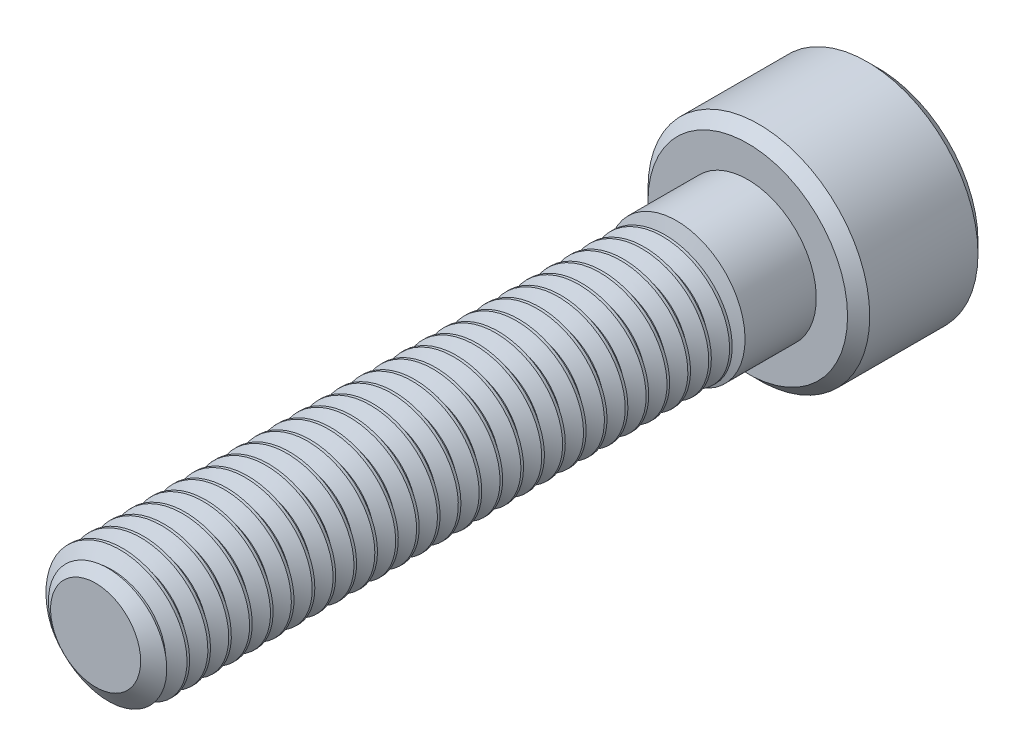
from build123d import *

# Parameters (mm, degrees)
SKETCH1_R          = 2.5
EXTRUDE1_DEPTH     = 25
CUT_SWEEP1_PITCH   = 0.8
SKETCH6_R          = 4.25
EXTRUDE2_DEPTH     = 5
CUT_EXTRUDE1_DEPTH = 3
CHAMFER1_SIZE      = 0.425


with BuildPart() as part:
    # Sketch1 → Extrude1 (new body)
    with BuildSketch(Plane.XY):
        Circle(SKETCH1_R)
    extrude(amount=-EXTRUDE1_DEPTH)

    # Cut-Sweep1: the profile of Sketch3 profile screwed along a right-hand helix of 32.25 turns, 6 arcs to a turn; built about Z, then put on its axis
    cut_sweep1_z = Axis((0, 0, 0), (0, 0, 1))
    cut_sweep1_corners = [(2.5003, 0, -0.700173205), (1.980384758, 0, -0.4), (1.980384758, 0, -0.3), (2.5003, 0, 0.000173205)]
    with BuildLine(mode=Mode.PRIVATE) as cut_sweep1_profile:
        Line(cut_sweep1_corners[0], cut_sweep1_corners[1])
        Line(cut_sweep1_corners[1], cut_sweep1_corners[2])
        Line(cut_sweep1_corners[2], cut_sweep1_corners[3])
        Line(cut_sweep1_corners[3], cut_sweep1_corners[0])
    cut_sweep1_cap = Face(cut_sweep1_profile.wire())
    cut_sweep1_turn_angles = [0, 30, 60, 90, 120, 150, 180, 210, 240, 270, 300, 330, 360]
    cut_sweep1_turn_weights = [1, 0.8660254037844387, 1, 0.8660254037844387, 1, 0.8660254037844387, 1, 0.8660254037844387, 1, 0.8660254037844387, 1, 0.8660254037844387, 1]
    cut_sweep1_turn_rails = [Edge.make_bspline([Vector(p[0], p[1], 0).rotate(cut_sweep1_z, cut_sweep1_turn_angles[k]) / cut_sweep1_turn_weights[k] + Vector(0, 0, p[2] + CUT_SWEEP1_PITCH * cut_sweep1_turn_angles[k] / 360) for k in range(13)], [0, 0, 0, 1, 1, 2, 2, 3, 3, 4, 4, 5, 5, 6, 6, 6], 2, cut_sweep1_turn_weights) for p in cut_sweep1_corners]
    cut_sweep1_turn_sides = [Face.make_surface_from_curves(cut_sweep1_turn_rails[p[0]], cut_sweep1_turn_rails[p[1]]) for p in [(0, 1), (1, 2), (2, 3), (3, 0)]]
    cut_sweep1_last_angles = [11520, 11550, 11580, 11595, 11610]
    cut_sweep1_last_weights = [1, 0.8660254037844387, 1, 0.9659258262891915, 1]
    cut_sweep1_last_rails = [Edge.make_bspline([Vector(p[0], p[1], 0).rotate(cut_sweep1_z, cut_sweep1_last_angles[k]) / cut_sweep1_last_weights[k] + Vector(0, 0, p[2] + CUT_SWEEP1_PITCH * cut_sweep1_last_angles[k] / 360) for k in range(5)], [0, 0, 0, 1, 1, 2, 2, 2], 2, cut_sweep1_last_weights) for p in cut_sweep1_corners]
    cut_sweep1_last_sides = [Face.make_surface_from_curves(cut_sweep1_last_rails[p[0]], cut_sweep1_last_rails[p[1]]) for p in [(0, 1), (1, 2), (2, 3), (3, 0)]]
    cut_sweep1 = Plane(origin=(0, 0, 0), x_dir=(0, 1, 0), z_dir=(0, 0, -1)) * Solid(Shell([*[p.moved(Location((0, 0, CUT_SWEEP1_PITCH * i))) for i in range(32) for p in cut_sweep1_turn_sides], *cut_sweep1_last_sides, cut_sweep1_cap, cut_sweep1_cap.rotate(cut_sweep1_z, 11610).moved(Location((0, 0, CUT_SWEEP1_PITCH * 11610 / 360)))]))
    add(cut_sweep1, mode=Mode.SUBTRACT)

    # Sketch4 → Cut-Revolve1 (revolve, cut)
    with BuildSketch(Plane(origin=(0, 0, 0), x_dir=(0, 0, -1), z_dir=(1, 0, 0)), mode=Mode.PRIVATE) as cut_revolve1_sk:
        Polygon((0.541691224, 2.5), (0, 1.726384758), (0, 2.5), align=None)
    revolve(cut_revolve1_sk.sketch.rotate(Axis((0, 0, 0), (0, 0, -1)), 260.43858876), axis=Axis((0, 0, 0), (0, 0, -1)), mode=Mode.SUBTRACT)

    # Sketch5 → partially thread (revolve)
    with BuildSketch(Plane(origin=(0, 0, 0), x_dir=(0, 0, -1), z_dir=(1, 0, 0)), mode=Mode.PRIVATE) as partially_thread_sk:
        Polygon((25, 2.627), (22.267949192, 2.627), (22, 1.627), (22, 0), (25, 0), align=None)
    revolve(partially_thread_sk.sketch.rotate(Axis((0, 0, 0), (0, 0, -1)), 357.397994159), axis=Axis((0, 0, 0), (0, 0, -1)))

    # Sketch6 → Extrude2 (add)
    with BuildSketch(Plane(origin=(0, 0, -25), x_dir=(-1, 0, 0), z_dir=(0, 0, -1))):
        Circle(SKETCH6_R)
    extrude(amount=EXTRUDE2_DEPTH)

    # Sketch7 → Cut-Extrude1 (cut)
    with BuildSketch(Plane(origin=(0, 0, -30), x_dir=(-1, 0, 0), z_dir=(0, 0, -1))):
        Polygon((0, 2.309401077), (-2, 1.154700538), (-2, -1.154700538), (0, -2.309401077), (2, -1.154700538), (2, 1.154700538), align=None)
    extrude(amount=-CUT_EXTRUDE1_DEPTH, mode=Mode.SUBTRACT)

    # Cut-Extrude2 cone 1 section (through the dimple's axis) → Cut-Extrude2 (revolve, cut)
    with BuildSketch(Plane(origin=(0, 0, -30), x_dir=(0, 1, 0), z_dir=(1, 0, 0))):
        Polygon((0, 0), (2.309401077, 0), (0, 2.309401077), align=None)
    revolve(axis=Axis((0, 0, -30), (0, 0, 1)), mode=Mode.SUBTRACT)

    # Chamfer1
    chamfer1_edges = [part.edges().sort_by_distance(p)[0] for p in [
        (4.25, 0, -25),
        (4.25, 0, -30),
    ]]
    chamfer(chamfer1_edges, length=CHAMFER1_SIZE)


solid = part.part
